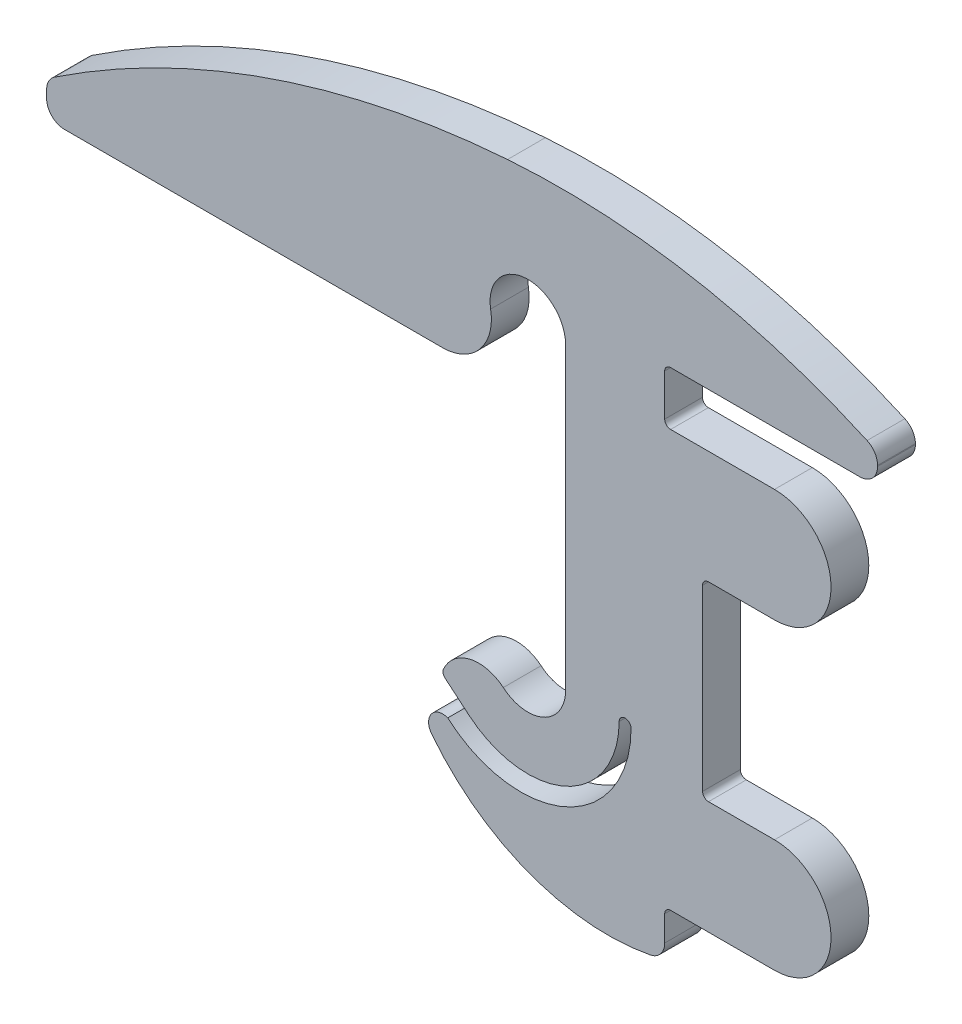
from build123d import *

# Parameters (mm, degrees)
BOSS_EXTRUDE1_DEPTH = 3.175
FILLET1_R           = 0.5
FILLET2_R           = 1.5


with BuildPart() as part:
    # Model → Boss-Extrude1 (new body)
    with BuildSketch(Plane.XY):
        with BuildLine():
            Line((14.682892141, 1.324956628), (14.682892141, -14.675043372))
            Line((14.682892141, -14.675043372), (20.7298505, -14.675043372))
            ThreePointArc((20.7298505, -14.675043372), (25.4798505, -19.425043372), (20.7298505, -24.175043372))
            Line((20.7298505, -24.175043372), (11.5, -24.175043372))
            Line((11.5, -24.175043372), (11.5, -28.004155183))
            ThreePointArc((11.5, -28.004155183), (0.71022918, -27.624612518), (-8.091185045, -21.371748005))
            ThreePointArc((-8.091185045, -21.371748005), (-8.108719309, -19.937278968), (-6.731529764, -19.535585272))
            ThreePointArc((-6.731529764, -19.535585272), (3.21430247, -21.04378196), (8.674974651, -12.595391853))
            ThreePointArc((8.674974651, -12.595391853), (8.175614462, -12.09535774), (7.674976202, -12.594112234))
            ThreePointArc((7.674976202, -12.594112234), (3.234931854, -19.534945465), (-4.933394903, -18.4543911))
            Line((-4.933394903, -18.4543911), (-7.231528234, -16.526028271))
            ThreePointArc((-7.231528234, -16.526028271), (-5.055570769, -14.381233606), (-2.061467679, -14.989741395))
            ThreePointArc((-2.061467679, -14.989741395), (1.32956104, -15.458208706), (3.175, -12.575000001))
            Line((3.175, -12.575000001), (3.175, 12.575000001))
            ThreePointArc((3.175, 12.575000001), (-0.276719482, 15.737918167), (-3.126764616, 12.023667038))
            ThreePointArc((-3.126764616, 12.023667038), (-4.027590212, 8.661740144), (-7.182015159, 7.190807634))
            Line((-7.182015159, 7.190807634), (-38.940555286, 7.190807634))
            ThreePointArc((-38.940555286, 7.190807634), (-40.001215458, 7.630147462), (-40.440555286, 8.690807634))
            Line((-40.440555286, 8.690807634), (-40.440555286, 9.332781994))
            ThreePointArc((-40.440555286, 9.332781994), (-40.26291966, 10.040844464), (-39.772085337, 10.581204108))
            ThreePointArc((-39.772085337, 10.581204108), (-21.582497329, 19.5655863), (-1.704175076, 23.619293202))
            ThreePointArc((-1.704175076, 23.619293202), (14.213621823, 22.738093196), (29.39280733, 17.865198893))
            Line((29.39280733, 17.865198893), (29.39280733, 15.324956628))
            Line((29.39280733, 15.324956628), (11.5, 15.324956628))
            Line((11.5, 15.324956628), (11.5, 10.824956628))
            Line((11.5, 10.824956628), (20.7298505, 10.824956628))
            ThreePointArc((20.7298505, 10.824956628), (25.4798505, 6.074956628), (20.7298505, 1.324956628))
            Line((20.7298505, 1.324956628), (14.682892141, 1.324956628))
        make_face()
    extrude(amount=BOSS_EXTRUDE1_DEPTH)

    # Fillet1
    fillet1_edges = [part.edges().sort_by_distance(p)[0] for p in [
        (-7.231528234, -16.526028271, 1.5875),
        (11.5, -24.175043372, 1.5875),
        (14.682892141, -14.675043372, 1.5875),
        (14.682892141, 1.324956628, 1.5875),
        (11.5, 10.824956628, 1.5875),
        (11.5, 15.324956628, 1.5875),
    ]]
    fillet(fillet1_edges, radius=FILLET1_R)

    # Fillet2
    fillet2_edges = [part.edges().sort_by_distance(p)[0] for p in [
        (11.5, -28.004155183, 1.5875),
        (29.39280733, 15.324956628, 1.5875),
        (29.39280733, 17.865198893, 1.5875),
    ]]
    fillet(fillet2_edges, radius=FILLET2_R)


solid = part.part
